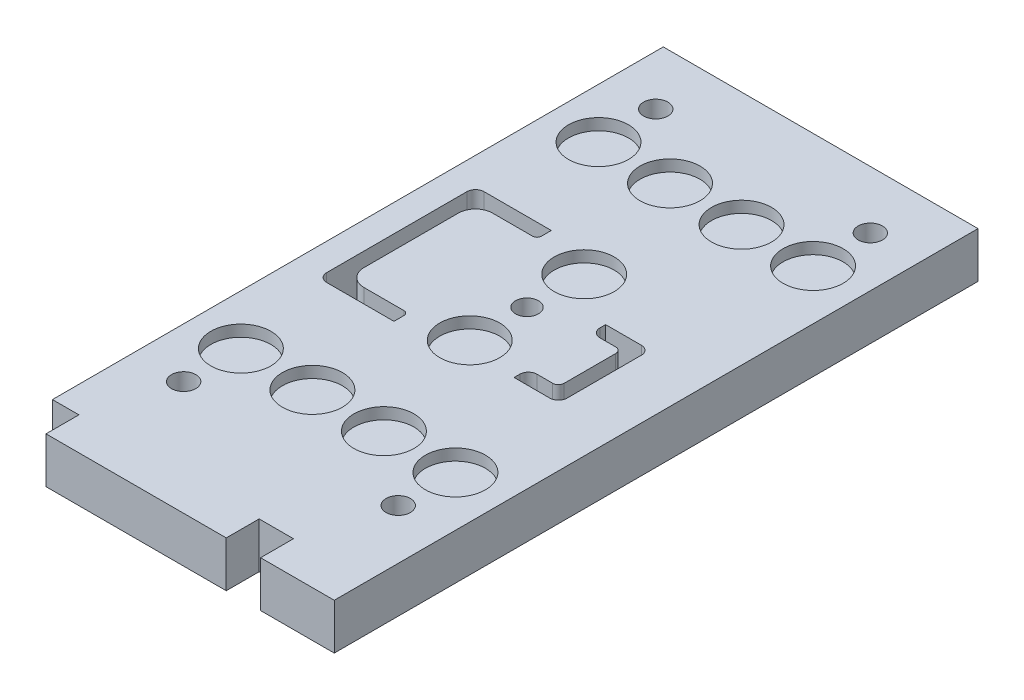
from build123d import *

# Parameters (mm, degrees)
SKETCH1_W           = 110
SKETCH1_H           = 225
BOSS_EXTRUDE1_DEPTH = 16
CUT_EXTRUDE1_REACH  = 128.243
CUT_EXTRUDE2_REACH  = 128.243
SKETCH4_R           = 8.5
CUT_EXTRUDE3_DEPTH  = 5
SKETCH5_R           = 10.5
CUT_EXTRUDE4_DEPTH  = 4
CUT_EXTRUDE5_REACH  = 128.243
SKETCH6_W           = 12
SKETCH6_H           = 11.5
M10_TAPPED_HOLE1_D  = 8.5
CUT_EXTRUDE6_REACH  = 128.243
SKETCH10_R          = 4


with BuildPart() as part:
    # Sketch1 → Boss-Extrude1 (new body)
    with BuildSketch(Plane(origin=(0, 0, 0), x_dir=(1, 0, 0), z_dir=(0, 1, 0))):
        Rectangle(SKETCH1_W, SKETCH1_H)
    extrude(amount=-BOSS_EXTRUDE1_DEPTH)

    # Sketch2 → Cut-Extrude1 (cut, up to next)
    with BuildSketch(Plane(origin=(0, 0, 0), x_dir=(1, 0, 0), z_dir=(0, 1, 0)), mode=Mode.PRIVATE) as cut_extrude1_sk1:
        with BuildLine():
            Line((-19, 37.36), (-19, 33.86))
            ThreePointArc((-19, 33.86), (-19.439339828, 32.799339828), (-20.5, 32.36))
            Line((-20.5, 32.36), (-34.5, 32.36))
            ThreePointArc((-34.5, 32.36), (-38.742640687, 30.602640687), (-40.5, 26.36))
            Line((-40.5, 26.36), (-40.5, -6.64))
            ThreePointArc((-40.5, -6.64), (-38.742640687, -10.882640687), (-34.5, -12.64))
            Line((-34.5, -12.64), (-20.5, -12.64))
            ThreePointArc((-20.5, -12.64), (-19.439339828, -13.079339828), (-19, -14.14))
            Line((-19, -14.14), (-19, -17.64))
            Line((-19, -17.64), (-42.5, -17.64))
            ThreePointArc((-42.5, -17.64), (-44.621320344, -16.761320344), (-45.5, -14.64))
            Line((-45.5, -14.64), (-45.5, 34.36))
            ThreePointArc((-45.5, 34.36), (-44.621320344, 36.481320344), (-42.5, 37.36))
            Line((-42.5, 37.36), (-19, 37.36))
        make_face()
    cut_extrude1_tool1 = extrude(cut_extrude1_sk1.sketch, amount=-CUT_EXTRUDE1_REACH, mode=Mode.PRIVATE) & part.part
    add(cut_extrude1_tool1.solids().sort_by_distance((-44.189623, 0, 16.329623))[0], mode=Mode.SUBTRACT)

    # Sketch3 → Cut-Extrude2 (cut, up to next)
    with BuildSketch(Plane(origin=(0, 0, 0), x_dir=(1, 0, 0), z_dir=(0, 1, 0)), mode=Mode.PRIVATE) as cut_extrude2_sk1:
        with BuildLine():
            Line((19, 18.36), (31.5, 18.36))
            ThreePointArc((31.5, 18.36), (33.621320344, 17.481320344), (34.5, 15.36))
            Line((34.5, 15.36), (34.5, -10.64))
            ThreePointArc((34.5, -10.64), (33.621320344, -12.761320344), (31.5, -13.64))
            Line((31.5, -13.64), (19, -13.64))
            Line((19, -13.64), (19, -11.64))
            ThreePointArc((19, -11.64), (19.878679656, -9.518679656), (22, -8.64))
            Line((22, -8.64), (27.5, -8.64))
            ThreePointArc((27.5, -8.64), (28.914213562, -8.054213562), (29.5, -6.64))
            Line((29.5, -6.64), (29.5, 11.36))
            ThreePointArc((29.5, 11.36), (28.914213562, 12.774213562), (27.5, 13.36))
            Line((27.5, 13.36), (22, 13.36))
            ThreePointArc((22, 13.36), (19.878679656, 14.238679656), (19, 16.36))
            Line((19, 16.36), (19, 18.36))
        make_face()
    cut_extrude2_tool1 = extrude(cut_extrude2_sk1.sketch, amount=-CUT_EXTRUDE2_REACH, mode=Mode.PRIVATE) & part.part
    add(cut_extrude2_tool1.solids().sort_by_distance((20.130101, 0, -14.490101))[0], mode=Mode.SUBTRACT)

    # Sketch4 → Cut-Extrude3 (cut)
    with BuildSketch(Plane.XZ.offset(16)):
        with Locations((0, 100)):
            Circle(SKETCH4_R)
        with Locations((0, -100)):
            Circle(SKETCH4_R)
    extrude(amount=-CUT_EXTRUDE3_DEPTH, mode=Mode.SUBTRACT)

    # Sketch5 → Cut-Extrude4 (cut)
    with BuildSketch(Plane(origin=(0, 0, 0), x_dir=(1, 0, 0), z_dir=(0, 1, 0))):
        with Locations((-37.5, 72.36)):
            Circle(SKETCH5_R)
        with Locations((-12.5, 72.36)):
            Circle(SKETCH5_R)
        with Locations((12.5, 72.36)):
            Circle(SKETCH5_R)
        with Locations((37.5, 72.36)):
            Circle(SKETCH5_R)
        with Locations((37.5, -52.64)):
            Circle(SKETCH5_R)
        with Locations((12.5, -52.64)):
            Circle(SKETCH5_R)
        with Locations((-12.5, -52.64)):
            Circle(SKETCH5_R)
        with Locations((-37.5, -52.64)):
            Circle(SKETCH5_R)
        with Locations((0, 29.86)):
            Circle(SKETCH5_R)
        with Locations((0, -10.14)):
            Circle(SKETCH5_R)
    extrude(amount=-CUT_EXTRUDE4_DEPTH, mode=Mode.SUBTRACT)

    # Sketch6 → Cut-Extrude5 (cut, up to next)
    with BuildSketch(Plane(origin=(0, 0, 0), x_dir=(1, 0, 0), z_dir=(0, 1, 0)), mode=Mode.PRIVATE) as cut_extrude5_sk1:
        with Locations((23.25, -106.75)):
            Rectangle(SKETCH6_W, SKETCH6_H)
    cut_extrude5_tool1 = extrude(cut_extrude5_sk1.sketch, amount=-CUT_EXTRUDE5_REACH, mode=Mode.PRIVATE) & part.part
    # Sketch6 → Cut-Extrude5 (cut, up to next)
    with BuildSketch(Plane(origin=(0, 0, 0), x_dir=(1, 0, 0), z_dir=(0, 1, 0)), mode=Mode.PRIVATE) as cut_extrude5_sk2:
        with Locations((-51.75, -106.75)):
            Rectangle(SKETCH6_W, SKETCH6_H)
    cut_extrude5_tool2 = extrude(cut_extrude5_sk2.sketch, amount=-CUT_EXTRUDE5_REACH, mode=Mode.PRIVATE) & part.part
    add(cut_extrude5_tool1.solids().sort_by_distance((23.25, 0, 106.75))[0], mode=Mode.SUBTRACT)
    add(cut_extrude5_tool2.solids().sort_by_distance((-51.75, 0, 106.75))[0], mode=Mode.SUBTRACT)

    # M10 Tapped Hole1 (through all)
    with Locations(Plane(origin=(0, 0, 0), x_dir=(1, 0, 0), z_dir=(0, 1, 0))):
        with Locations((-37.5, -72.64), (37.5, -72.64), (37.5, 92.36), (-37.5, 92.36)):
            Hole(M10_TAPPED_HOLE1_D / 2)

    # Sketch10 → Cut-Extrude6 (cut, up to next)
    with BuildSketch(Plane(origin=(0, 0, 0), x_dir=(1, 0, 0), z_dir=(0, 1, 0)), mode=Mode.PRIVATE) as cut_extrude6_sk1:
        with Locations((0, 9.86)):
            Circle(SKETCH10_R)
    cut_extrude6_tool1 = extrude(cut_extrude6_sk1.sketch, amount=-CUT_EXTRUDE6_REACH, mode=Mode.PRIVATE) & part.part
    add(cut_extrude6_tool1.solids().sort_by_distance((0, 0, -9.86))[0], mode=Mode.SUBTRACT)


solid = part.part
